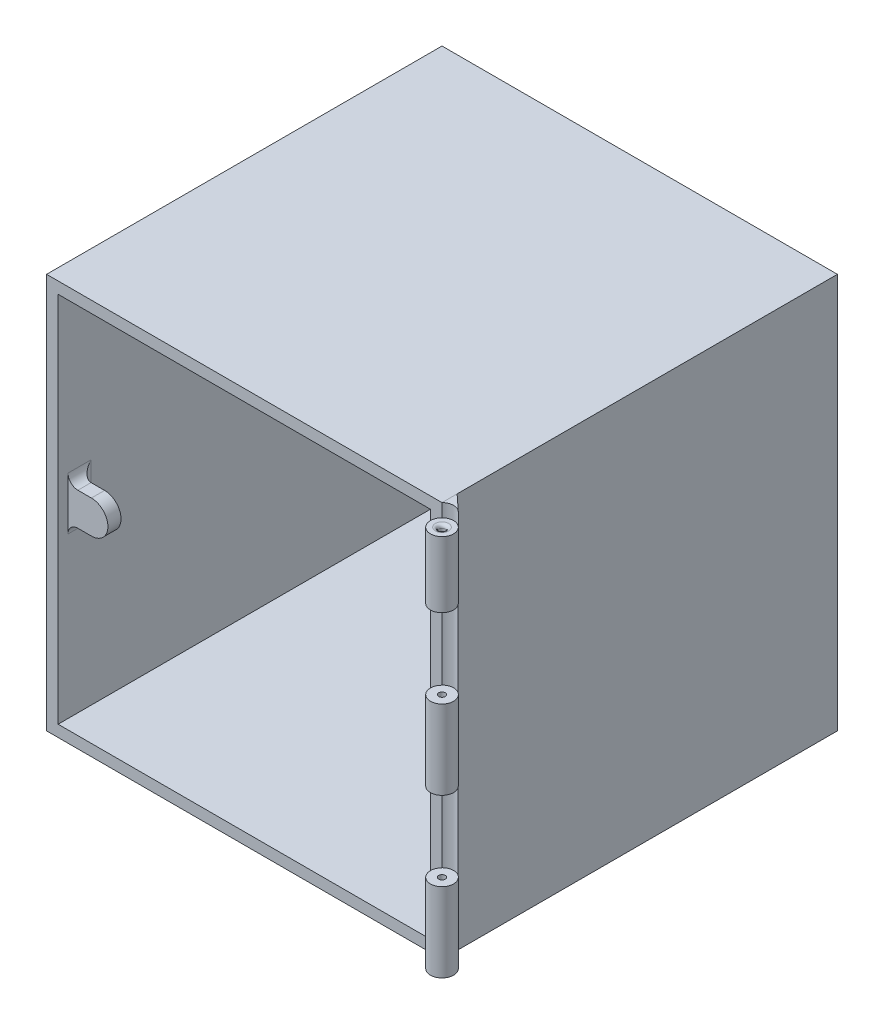
from build123d import *

# Parameters (mm, degrees)
ESBO_O2_W                = 120
ESBO_O2_H                = 120
RESSALTO_EXTRUS_O1_DEPTH = 120
ESBO_O3_W                = 113
ESBO_O3_H                = 113
CORTE_EXTRUS_O1_DEPTH    = 120
RESSALTO_EXTRUS_O2_DEPTH = 7
RESSALTO_EXTRUS_O4_DEPTH = 60
ESBO_O7_R                = 3.55
CORTE_EXTRUS_O2_DEPTH    = 24
ESBO_O8_R                = 3.55
CORTE_EXTRUS_O3_DEPTH    = 24
ESBO_O9_R                = 1
CORTE_EXTRUS_O4_DEPTH    = 110
ESBO_O10_R               = 3.5
CORTE_EXTRUS_O5_DEPTH    = 4
FILETE1_R                = 1
RESSALTO_EXTRUS_O5_DEPTH = 4
FILETE2_R                = 3
RESSALTO_EXTRUS_O6_DEPTH = 7


with BuildPart() as part:
    # Esboço2 → Ressalto-extrusão1 (new body)
    with BuildSketch(Plane.XY):
        Rectangle(ESBO_O2_W, ESBO_O2_H)
    extrude(amount=RESSALTO_EXTRUS_O1_DEPTH)

    # Esboço3 → Corte-extrusão1 (cut)
    with BuildSketch(Plane.XY.offset(120)):
        Rectangle(ESBO_O3_W, ESBO_O3_H)
    extrude(amount=-CORTE_EXTRUS_O1_DEPTH, mode=Mode.SUBTRACT)

    # Esboço4 → Ressalto-extrusão2 (add)
    with BuildSketch(Plane.XY):
        with BuildLine():
            Line((-51.5, 46.5), (-56.5, 46.5))
            Line((-56.5, 46.5), (-56.5, 56.5))
            Line((-56.5, 56.5), (-46.5, 56.5))
            Line((-46.5, 56.5), (-46.5, 51.5))
            ThreePointArc((-46.5, 51.5), (-47.964466094, 47.964466094), (-51.5, 46.5))
        make_face()
        with BuildLine():
            Line((46.5, 56.5), (46.5, 51.5))
            ThreePointArc((46.5, 51.5), (47.964466094, 47.964466094), (51.5, 46.5))
            Line((51.5, 46.5), (56.5, 46.5))
            Line((56.5, 46.5), (56.5, 56.5))
            Line((56.5, 56.5), (46.5, 56.5))
        make_face()
        with BuildLine():
            Line((51.5, -46.5), (56.5, -46.5))
            Line((56.5, -46.5), (56.5, -56.5))
            Line((56.5, -56.5), (46.5, -56.5))
            Line((46.5, -56.5), (46.5, -51.5))
            ThreePointArc((46.5, -51.5), (47.964466094, -47.964466094), (51.5, -46.5))
        make_face()
        with BuildLine():
            Line((-46.5, -56.5), (-46.5, -51.5))
            ThreePointArc((-46.5, -51.5), (-47.964466094, -47.964466094), (-51.5, -46.5))
            Line((-51.5, -46.5), (-56.5, -46.5))
            Line((-56.5, -46.5), (-56.5, -56.5))
            Line((-56.5, -56.5), (-46.5, -56.5))
        make_face()
        with BuildLine():
            Line((-51.5, 5), (-56.5, 5))
            Line((-56.5, 5), (-56.5, -5))
            Line((-56.5, -5), (-51.5, -5))
            ThreePointArc((-51.5, -5), (-46.5, 0), (-51.5, 5))
        make_face()
        with BuildLine():
            Line((56.5, -5), (51.5, -5))
            ThreePointArc((51.5, -5), (46.5, 0), (51.5, 5))
            Line((51.5, 5), (56.5, 5))
            Line((56.5, 5), (56.5, -5))
        make_face()
        with BuildLine():
            Line((-5, 51.5), (-5, 56.5))
            Line((-5, 56.5), (5, 56.5))
            Line((5, 56.5), (5, 51.5))
            ThreePointArc((5, 51.5), (0, 46.5), (-5, 51.5))
        make_face()
    extrude(amount=RESSALTO_EXTRUS_O2_DEPTH)


with BuildPart() as body_2:
    # Esboço6 → Ressalto-extrusão4 (new, symmetric)
    with BuildSketch(Plane(origin=(0, 0, 0), x_dir=(1, 0, 0), z_dir=(0, 1, 0))):
        with BuildLine():
            Line((60, -120), (60, -115.413760916))
            Line((60, -115.413760916), (64.817598383, -119.874558134))
            ThreePointArc((64.817598383, -119.874558134), (62.565976756, -125.973687853), (60, -120))
        make_face()
    extrude(amount=RESSALTO_EXTRUS_O4_DEPTH, both=True)


with BuildPart() as corte_extrus_o2_tool:
    # Esboço7 → Corte-extrusão2 (new body)
    with BuildSketch(Plane(origin=(0, 36, 0), x_dir=(1, 0, 0), z_dir=(0, 1, 0))):
        with Locations((62.474873734, -122.474873734)):
            Circle(ESBO_O7_R)
    extrude(amount=-CORTE_EXTRUS_O2_DEPTH)


with BuildPart() as part_1:
    add(part.part)

    # Corte-extrusão2: cut by corte_extrus_o2_tool
    add(corte_extrus_o2_tool.part, mode=Mode.SUBTRACT)


with BuildPart() as body_2_1:
    add(body_2.part)

    # Corte-extrusão2: cut by corte_extrus_o2_tool
    add(corte_extrus_o2_tool.part, mode=Mode.SUBTRACT)


with BuildPart() as corte_extrus_o3_tool:
    # Esboço8 → Corte-extrusão3 (new body)
    with BuildSketch(Plane(origin=(0, -12, 0), x_dir=(1, 0, 0), z_dir=(0, 1, 0))):
        with Locations((62.474873734, -122.474873734)):
            Circle(ESBO_O8_R)
    extrude(amount=-CORTE_EXTRUS_O3_DEPTH)


with BuildPart() as part_2:
    add(part_1.part)

    # Corte-extrusão3: cut by corte_extrus_o3_tool
    add(corte_extrus_o3_tool.part, mode=Mode.SUBTRACT)

    # Esboço11 → Ressalto-extrusão5 (add)
    with BuildSketch(Plane.XY.offset(117)):
        with BuildLine():
            Line((-49.4, 5), (-56.5, 5))
            Line((-56.5, 5), (-56.5, -5))
            Line((-56.5, -5), (-49.4, -5))
            ThreePointArc((-49.4, -5), (-44.4, 0), (-49.4, 5))
        make_face()
    extrude(amount=-RESSALTO_EXTRUS_O5_DEPTH)

    # Filete2
    filete2_edges = [part_2.edges().sort_by_distance(p)[0] for p in [
        (-56.5, 5, 115),
        (-56.5, -5, 115),
        (-56.5, 0, 113),
    ]]
    fillet(filete2_edges, radius=FILETE2_R)

    # Esboço13 → Ressalto-extrusão6 (add)
    with BuildSketch(Plane.XY):
        with BuildLine():
            Line((-5, -51.5), (-5, -56.5))
            Line((-5, -56.5), (5, -56.5))
            Line((5, -56.5), (5, -51.5))
            ThreePointArc((5, -51.5), (0, -46.5), (-5, -51.5))
        make_face()
    extrude(amount=RESSALTO_EXTRUS_O6_DEPTH)


with BuildPart() as body_2_2:
    add(body_2_1.part)

    # Corte-extrusão3: cut by corte_extrus_o3_tool
    add(corte_extrus_o3_tool.part, mode=Mode.SUBTRACT)

    # Esboço9 → Corte-extrusão4 (cut)
    with BuildSketch(Plane(origin=(0, 60, 0), x_dir=(1, 0, 0), z_dir=(0, 1, 0))):
        with Locations((62.474873734, -122.474873734)):
            Circle(ESBO_O9_R)
    extrude(amount=-CORTE_EXTRUS_O4_DEPTH, mode=Mode.SUBTRACT)

    # Esboço10 → Corte-extrusão5 (cut)
    with BuildSketch(Plane(origin=(0, 60, 0), x_dir=(1, 0, 0), z_dir=(0, 1, 0))):
        with Locations((62.474873734, -122.474873734)):
            Circle(ESBO_O10_R)
    extrude(amount=-CORTE_EXTRUS_O5_DEPTH, mode=Mode.SUBTRACT)

    # Filete1
    filete1_edges = [body_2_2.edges().sort_by_distance(p)[0] for p in [
        (61.474873734, 56, 122.474873734),
    ]]
    fillet(filete1_edges, radius=FILETE1_R)


solid = Compound([part_2.part, body_2_2.part])
